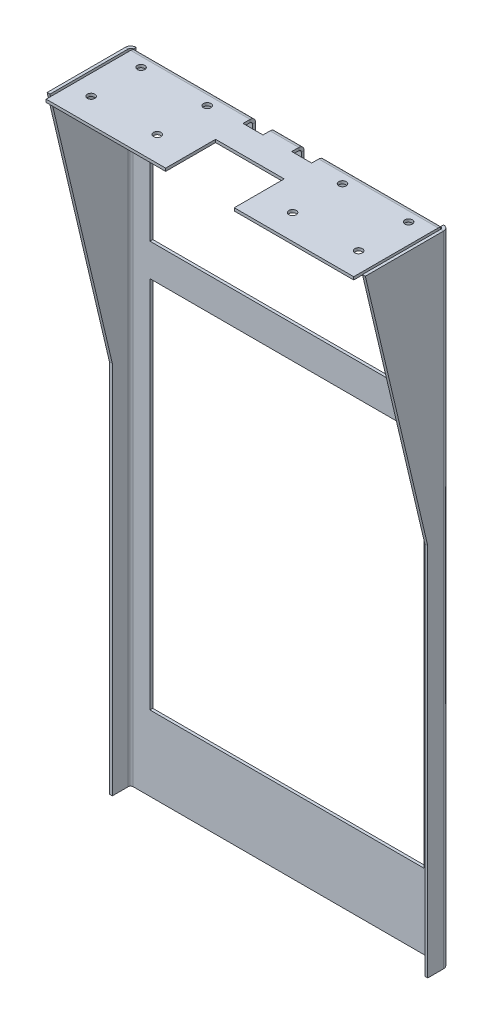
from build123d import *

# Parameters (mm, degrees)
SKETCH1_W                    = 255
SKETCH1_H                    = 512
BASE_FLANGE1_DEPTH           = 2.3
EDGE_FLANGE2_STRIP_W         = 13.2
EDGE_FLANGE2_STRIP_H         = 2.3
EDGE_FLANGE2_STRIP_CUT_DEPTH = 512
EDGE_FLANGE2_DEPTH           = 512
EDGE_FLANGE3_STRIP_W         = 13.2
EDGE_FLANGE3_STRIP_H         = 2.3
EDGE_FLANGE3_STRIP_CUT_DEPTH = 512
EDGE_FLANGE3_DEPTH           = 512
CUT_EXTRUDE2_START           = -10
CUT_EXTRUDE2_DEPTH           = 586.634510779
EDGE_FLANGE4_STRIP_W         = 13.2
EDGE_FLANGE4_STRIP_H         = 2.3
EDGE_FLANGE4_STRIP_CUT_DEPTH = 246.4
EDGE_FLANGE4_DEPTH           = 246.4
CUT_EXTRUDE3_REACH           = 578.501
SKETCH23_W                   = 219.6
SKETCH23_H                   = 299.3
CUT_EXTRUDE4_REACH           = 578.501
SKETCH24_W                   = 219.6
SKETCH24_H                   = 105
CUT_EXTRUDE6_REACH           = 576.175
SKETCH25_W                   = 55
SKETCH25_H                   = 40
CUT_EXTRUDE7_REACH           = 578.218
SKETCH27_W                   = 16
SKETCH27_H                   = 10
CUT_EXTRUDE8_REACH           = 578.501
SKETCH28_R                   = 5
CUT_EXTRUDE9_REACH           = 578.501
SKETCH29_R                   = 1.75
CUT_EXTRUDE10_REACH          = 578.218
SKETCH30_R                   = 3


# Sheet-metal steps are written as plain solids
with BuildPart() as part:
    # Sketch1 → Base-Flange1 (new body)
    with BuildSketch(Plane.XY):
        with Locations((127.5, 256)):
            Rectangle(SKETCH1_W, SKETCH1_H)
    extrude(amount=-BASE_FLANGE1_DEPTH)

    # Edge-Flange2 strip (across the edge) → Edge-Flange2 strip cut (cut)
    with BuildSketch(Plane(origin=(255, 0, 0), x_dir=(-1, 0, 0), z_dir=(0, 1, 0))):
        with Locations((-2.3, -1.15)):
            Rectangle(EDGE_FLANGE2_STRIP_W, EDGE_FLANGE2_STRIP_H)
    extrude(amount=EDGE_FLANGE2_STRIP_CUT_DEPTH, mode=Mode.SUBTRACT)

    # Edge-Flange2 section (across the edge) → Edge-Flange2 (add)
    with BuildSketch(Plane(origin=(255, 0, 0), x_dir=(-1, 0, 0), z_dir=(0, 1, 0))):
        with BuildLine():
            Line((0, 2), (0, 64.7))
            Line((0, 64.7), (2.3, 64.7))
            Line((2.3, 64.7), (2.3, 2))
            ThreePointArc((2.3, 2), (2.885786438, 0.585786438), (4.3, 0))
            Line((4.3, 0), (4.3, -2.3))
            ThreePointArc((4.3, -2.3), (1.259440841, -1.040559159), (0, 2))
        make_face()
    extrude(amount=EDGE_FLANGE2_DEPTH)

    # Edge-Flange3 strip (across the edge) → Edge-Flange3 strip cut (cut)
    with BuildSketch(Plane.XZ.offset(-512)):
        with Locations((-2.3, -1.15)):
            Rectangle(EDGE_FLANGE3_STRIP_W, EDGE_FLANGE3_STRIP_H)
    extrude(amount=EDGE_FLANGE3_STRIP_CUT_DEPTH, mode=Mode.SUBTRACT)

    # Edge-Flange3 section (across the edge) → Edge-Flange3 (add)
    with BuildSketch(Plane.XZ.offset(-512)):
        with BuildLine():
            Line((0, 2), (0, 64.7))
            Line((0, 64.7), (2.3, 64.7))
            Line((2.3, 64.7), (2.3, 2))
            ThreePointArc((2.3, 2), (2.885786438, 0.585786438), (4.3, 0))
            Line((4.3, 0), (4.3, -2.3))
            ThreePointArc((4.3, -2.3), (1.259440841, -1.040559159), (0, 2))
        make_face()
    extrude(amount=EDGE_FLANGE3_DEPTH)

    # Sketch17 → Cut-Extrude2 (cut)
    with BuildSketch(Plane(origin=(255, 0, 0), x_dir=(0, 0, -1), z_dir=(1, 0, 0)).offset(CUT_EXTRUDE2_START)):
        Polygon((-14.7, -1042.730361711), (-14.7, 0), (-14.7, 300), (-64.7, 512), (-64.7, 0), (-64.7, -1042.730361711), (-64.7, -3128.191085133), (-14.7, -3128.191085133), align=None)
    cut_extrude2 = extrude(amount=CUT_EXTRUDE2_DEPTH, mode=Mode.SUBTRACT)

    # Mirror6: Cut-Extrude2 across plane
    add(cut_extrude2.mirror(Plane(origin=(126.35, 0, 0), x_dir=(0, 0, 1), z_dir=(1, 0, 0))), mode=Mode.SUBTRACT)

    # Edge-Flange4 strip (across the edge) → Edge-Flange4 strip cut (cut)
    with BuildSketch(Plane(origin=(250.7, 512, 0), x_dir=(0, -1, 0), z_dir=(-1, 0, 0))):
        with Locations((-2.3, -1.15)):
            Rectangle(EDGE_FLANGE4_STRIP_W, EDGE_FLANGE4_STRIP_H)
    extrude(amount=EDGE_FLANGE4_STRIP_CUT_DEPTH, mode=Mode.SUBTRACT)

    # Edge-Flange4 section (across the edge) → Edge-Flange4 (add)
    with BuildSketch(Plane(origin=(250.7, 512, 0), x_dir=(0, -1, 0), z_dir=(-1, 0, 0))):
        with BuildLine():
            Line((0, 2), (0, 69.7))
            Line((0, 69.7), (2.3, 69.7))
            Line((2.3, 69.7), (2.3, 2))
            ThreePointArc((2.3, 2), (2.885786438, 0.585786438), (4.3, 0))
            Line((4.3, 0), (4.3, -2.3))
            ThreePointArc((4.3, -2.3), (1.259440841, -1.040559159), (0, 2))
        make_face()
    extrude(amount=EDGE_FLANGE4_DEPTH)

    # Sketch23 → Cut-Extrude3 (cut, up to next)
    with BuildSketch(Plane(origin=(0, 0, -2.3), x_dir=(-1, 0, 0), z_dir=(0, 0, -1)), mode=Mode.PRIVATE) as cut_extrude3_sk1:
        with Locations((-127.5, 209.65)):
            Rectangle(SKETCH23_W, SKETCH23_H)
    cut_extrude3_tool1 = extrude(cut_extrude3_sk1.sketch, amount=-CUT_EXTRUDE3_REACH, mode=Mode.PRIVATE) & part.part
    add(cut_extrude3_tool1.solids().sort_by_distance((127.5, 209.65, -2.3))[0], mode=Mode.SUBTRACT)

    # Sketch24 → Cut-Extrude4 (cut, up to next)
    with BuildSketch(Plane(origin=(0, 0, -2.3), x_dir=(-1, 0, 0), z_dir=(0, 0, -1)), mode=Mode.PRIVATE) as cut_extrude4_sk1:
        with Locations((-127.5, 437.8)):
            Rectangle(SKETCH24_W, SKETCH24_H)
    cut_extrude4_tool1 = extrude(cut_extrude4_sk1.sketch, amount=-CUT_EXTRUDE4_REACH, mode=Mode.PRIVATE) & part.part
    add(cut_extrude4_tool1.solids().sort_by_distance((127.5, 437.8, -2.3))[0], mode=Mode.SUBTRACT)

    # Sketch25 → Cut-Extrude6 (cut, up to next)
    with BuildSketch(Plane.XZ.offset(-509.7), mode=Mode.PRIVATE) as cut_extrude6_sk1:
        with Locations((127.5, 49.7)):
            Rectangle(SKETCH25_W, SKETCH25_H)
    cut_extrude6_tool1 = extrude(cut_extrude6_sk1.sketch, amount=-CUT_EXTRUDE6_REACH, mode=Mode.PRIVATE) & part.part
    add(cut_extrude6_tool1.solids().sort_by_distance((127.5, 509.7, 49.7))[0], mode=Mode.SUBTRACT)

    # Sketch27 → Cut-Extrude7 (cut, up to next)
    with BuildSketch(Plane(origin=(0, 512, 0), x_dir=(1, 0, 0), z_dir=(0, 1, 0)), mode=Mode.PRIVATE) as cut_extrude7_sk1:
        with Locations((108, -2.7)):
            Rectangle(SKETCH27_W, SKETCH27_H)
    cut_extrude7_tool1 = extrude(cut_extrude7_sk1.sketch, amount=-CUT_EXTRUDE7_REACH, mode=Mode.PRIVATE) & part.part
    # Sketch27 → Cut-Extrude7 (cut, up to next)
    with BuildSketch(Plane(origin=(0, 512, 0), x_dir=(1, 0, 0), z_dir=(0, 1, 0)), mode=Mode.PRIVATE) as cut_extrude7_sk2:
        with Locations((147, -2.7)):
            Rectangle(SKETCH27_W, SKETCH27_H)
    cut_extrude7_tool2 = extrude(cut_extrude7_sk2.sketch, amount=-CUT_EXTRUDE7_REACH, mode=Mode.PRIVATE) & part.part
    add(cut_extrude7_tool1.solids().sort_by_distance((108, 512, 2.7))[0], mode=Mode.SUBTRACT)
    add(cut_extrude7_tool2.solids().sort_by_distance((147, 512, 2.7))[0], mode=Mode.SUBTRACT)

    # Sketch28 → Cut-Extrude8 (cut, up to next)
    with BuildSketch(Plane(origin=(0, 0, -2.3), x_dir=(-1, 0, 0), z_dir=(0, 0, -1)), mode=Mode.PRIVATE) as cut_extrude8_sk1:
        with Locations((-127.5, 496)):
            Circle(SKETCH28_R)
    cut_extrude8_tool1 = extrude(cut_extrude8_sk1.sketch, amount=-CUT_EXTRUDE8_REACH, mode=Mode.PRIVATE) & part.part
    add(cut_extrude8_tool1.solids().sort_by_distance((127.5, 496, -2.3))[0], mode=Mode.SUBTRACT)

    # Sketch29 → Cut-Extrude9 (cut, up to next)
    with BuildSketch(Plane(origin=(0, 0, -2.3), x_dir=(-1, 0, 0), z_dir=(0, 0, -1)), mode=Mode.PRIVATE) as cut_extrude9_sk1:
        with Locations((-119.46, 496)):
            Circle(SKETCH29_R)
    cut_extrude9_tool1 = extrude(cut_extrude9_sk1.sketch, amount=-CUT_EXTRUDE9_REACH, mode=Mode.PRIVATE) & part.part
    # Sketch29 → Cut-Extrude9 (cut, up to next)
    with BuildSketch(Plane(origin=(0, 0, -2.3), x_dir=(-1, 0, 0), z_dir=(0, 0, -1)), mode=Mode.PRIVATE) as cut_extrude9_sk2:
        with Locations((-135.54, 496)):
            Circle(SKETCH29_R)
    cut_extrude9_tool2 = extrude(cut_extrude9_sk2.sketch, amount=-CUT_EXTRUDE9_REACH, mode=Mode.PRIVATE) & part.part
    add(cut_extrude9_tool1.solids().sort_by_distance((119.46, 496, -2.3))[0], mode=Mode.SUBTRACT)
    add(cut_extrude9_tool2.solids().sort_by_distance((135.54, 496, -2.3))[0], mode=Mode.SUBTRACT)

    # Sketch30 → Cut-Extrude10 (cut, up to next)
    with BuildSketch(Plane(origin=(0, 512, 0), x_dir=(1, 0, 0), z_dir=(0, 1, 0)), mode=Mode.PRIVATE) as cut_extrude10_sk1:
        with Locations(Location((20.3, -9.700000578, 0), (0, 0, 270))):
            Circle(SKETCH30_R)
    cut_extrude10_tool1 = extrude(cut_extrude10_sk1.sketch, amount=-CUT_EXTRUDE10_REACH, mode=Mode.PRIVATE) & part.part
    # Sketch30 → Cut-Extrude10 (cut, up to next)
    with BuildSketch(Plane(origin=(0, 512, 0), x_dir=(1, 0, 0), z_dir=(0, 1, 0)), mode=Mode.PRIVATE) as cut_extrude10_sk2:
        with Locations(Location((73.3, -9.700000578, 0), (0, 0, 270))):
            Circle(SKETCH30_R)
    cut_extrude10_tool2 = extrude(cut_extrude10_sk2.sketch, amount=-CUT_EXTRUDE10_REACH, mode=Mode.PRIVATE) & part.part
    # Sketch30 → Cut-Extrude10 (cut, up to next)
    with BuildSketch(Plane(origin=(0, 512, 0), x_dir=(1, 0, 0), z_dir=(0, 1, 0)), mode=Mode.PRIVATE) as cut_extrude10_sk3:
        with Locations(Location((20.306798441, -49.7, 0), (0, 0, 270))):
            Circle(SKETCH30_R)
    cut_extrude10_tool3 = extrude(cut_extrude10_sk3.sketch, amount=-CUT_EXTRUDE10_REACH, mode=Mode.PRIVATE) & part.part
    # Sketch30 → Cut-Extrude10 (cut, up to next)
    with BuildSketch(Plane(origin=(0, 512, 0), x_dir=(1, 0, 0), z_dir=(0, 1, 0)), mode=Mode.PRIVATE) as cut_extrude10_sk4:
        with Locations(Location((73.306798441, -49.7, 0), (0, 0, 270))):
            Circle(SKETCH30_R)
    cut_extrude10_tool4 = extrude(cut_extrude10_sk4.sketch, amount=-CUT_EXTRUDE10_REACH, mode=Mode.PRIVATE) & part.part
    # Sketch30 → Cut-Extrude10 (cut, up to next)
    with BuildSketch(Plane(origin=(0, 512, 0), x_dir=(1, 0, 0), z_dir=(0, 1, 0)), mode=Mode.PRIVATE) as cut_extrude10_sk5:
        with Locations(Location((181.693201559, -49.7, 0), (0, 0, 90))):
            Circle(SKETCH30_R)
    cut_extrude10_tool5 = extrude(cut_extrude10_sk5.sketch, amount=-CUT_EXTRUDE10_REACH, mode=Mode.PRIVATE) & part.part
    # Sketch30 → Cut-Extrude10 (cut, up to next)
    with BuildSketch(Plane(origin=(0, 512, 0), x_dir=(1, 0, 0), z_dir=(0, 1, 0)), mode=Mode.PRIVATE) as cut_extrude10_sk6:
        with Locations(Location((234.693201559, -49.7, 0), (0, 0, 90))):
            Circle(SKETCH30_R)
    cut_extrude10_tool6 = extrude(cut_extrude10_sk6.sketch, amount=-CUT_EXTRUDE10_REACH, mode=Mode.PRIVATE) & part.part
    # Sketch30 → Cut-Extrude10 (cut, up to next)
    with BuildSketch(Plane(origin=(0, 512, 0), x_dir=(1, 0, 0), z_dir=(0, 1, 0)), mode=Mode.PRIVATE) as cut_extrude10_sk7:
        with Locations(Location((181.7, -9.700000578, 0), (0, 0, 90))):
            Circle(SKETCH30_R)
    cut_extrude10_tool7 = extrude(cut_extrude10_sk7.sketch, amount=-CUT_EXTRUDE10_REACH, mode=Mode.PRIVATE) & part.part
    # Sketch30 → Cut-Extrude10 (cut, up to next)
    with BuildSketch(Plane(origin=(0, 512, 0), x_dir=(1, 0, 0), z_dir=(0, 1, 0)), mode=Mode.PRIVATE) as cut_extrude10_sk8:
        with Locations(Location((234.7, -9.700000578, 0), (0, 0, 90))):
            Circle(SKETCH30_R)
    cut_extrude10_tool8 = extrude(cut_extrude10_sk8.sketch, amount=-CUT_EXTRUDE10_REACH, mode=Mode.PRIVATE) & part.part
    add(cut_extrude10_tool1.solids().sort_by_distance((20.3, 512, 9.700001))[0], mode=Mode.SUBTRACT)
    add(cut_extrude10_tool2.solids().sort_by_distance((73.3, 512, 9.700001))[0], mode=Mode.SUBTRACT)
    add(cut_extrude10_tool3.solids().sort_by_distance((20.306798, 512, 49.7))[0], mode=Mode.SUBTRACT)
    add(cut_extrude10_tool4.solids().sort_by_distance((73.306798, 512, 49.7))[0], mode=Mode.SUBTRACT)
    add(cut_extrude10_tool5.solids().sort_by_distance((181.693202, 512, 49.7))[0], mode=Mode.SUBTRACT)
    add(cut_extrude10_tool6.solids().sort_by_distance((234.693202, 512, 49.7))[0], mode=Mode.SUBTRACT)
    add(cut_extrude10_tool7.solids().sort_by_distance((181.7, 512, 9.700001))[0], mode=Mode.SUBTRACT)
    add(cut_extrude10_tool8.solids().sort_by_distance((234.7, 512, 9.700001))[0], mode=Mode.SUBTRACT)


solid = part.part
